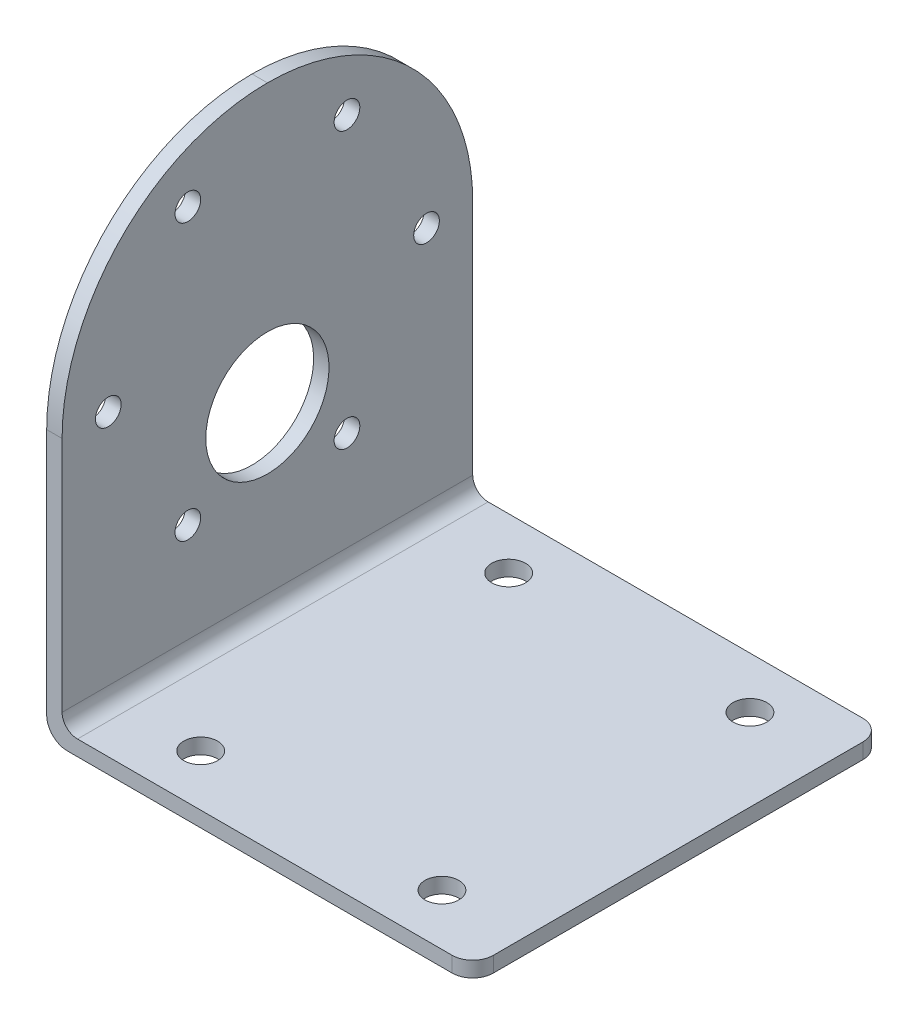
from build123d import *

# Parameters (mm, degrees)
SKETCH_1_W          = 41.5
SKETCH_1_H          = 40
EXTRUDE_1_DEPTH     = 1.5
SKETCH_2_W          = 1.5
SKETCH_2_H          = 40
EXTRUDE_2_DEPTH     = 44.6
FILLET_2_R          = 20
FILLET_3_R          = 20
SKETCH_3_R          = 1.25
SKETCH_3_R_2        = 6
CUT_EXTRUDE_1_DEPTH = 44.6
SKETCH_4_R          = 1.65
CUT_EXTRUDE_2_DEPTH = 44.6
FILLET_5_R          = 2
FILLET_6_R          = 2
FILLET_7_R          = 1.5


with BuildPart() as part:
    # Эскиз1 → Бобышка-Вытянуть1 (new body)
    with BuildSketch(Plane(origin=(0, 0, 0), x_dir=(1, 0, 0), z_dir=(0, 1, 0))):
        Rectangle(SKETCH_1_W, SKETCH_1_H)
    extrude(amount=EXTRUDE_1_DEPTH)

    # Эскиз2 → Бобышка-Вытянуть2 (add)
    with BuildSketch(Plane(origin=(0, 1.5, 0), x_dir=(1, 0, 0), z_dir=(0, 1, 0))):
        with Locations((-20, 0)):
            Rectangle(SKETCH_2_W, SKETCH_2_H)
    extrude(amount=EXTRUDE_2_DEPTH)

    # Скругление2
    fillet_2_edges = [part.edges().sort_by_distance(p)[0] for p in [
        (-20, 46.1, 20),
    ]]
    fillet(fillet_2_edges, radius=FILLET_2_R)

    # Скругление3
    fillet_3_edges = [part.edges().sort_by_distance(p)[0] for p in [
        (-20, 46.1, -20),
    ]]
    fillet(fillet_3_edges, radius=FILLET_3_R - 0.0001)  # a hair under: the kernel refuses the full size

    # Эскиз3 → Вырез-Вытянуть1 (cut)
    with BuildSketch(Plane.ZY.offset(20.75)):
        with Locations((-15.5, 26.1)):
            Circle(SKETCH_3_R)
        with Locations((-7.75, 39.523393759)):
            Circle(SKETCH_3_R)
        with Locations((7.75, 39.523393759)):
            Circle(SKETCH_3_R)
        with Locations((15.5, 26.1)):
            Circle(SKETCH_3_R)
        with Locations((7.75, 12.676606241)):
            Circle(SKETCH_3_R)
        with Locations((-7.75, 12.676606241)):
            Circle(SKETCH_3_R)
        with Locations((0, 19.1)):
            Circle(SKETCH_3_R_2)
    extrude(amount=-CUT_EXTRUDE_1_DEPTH, mode=Mode.SUBTRACT)

    # Эскиз4 → Вырез-Вытянуть2 (cut)
    with BuildSketch(Plane.XZ):
        with Locations(Location((12.75, 15, 0), (0, 0, 270))):
            Circle(SKETCH_4_R)
        with Locations(Location((-10.75, 15, 0), (0, 0, 270))):
            Circle(SKETCH_4_R)
        with Locations(Location((-10.75, -15, 0), (0, 0, 270))):
            Circle(SKETCH_4_R)
        with Locations(Location((12.75, -15, 0), (0, 0, 270))):
            Circle(SKETCH_4_R)
    extrude(amount=-CUT_EXTRUDE_2_DEPTH, mode=Mode.SUBTRACT)

    # Скругление5
    fillet_5_edges = [part.edges().sort_by_distance(p)[0] for p in [
        (20.75, 0.75, -20),
        (20.75, 0.75, 20),
    ]]
    fillet(fillet_5_edges, radius=FILLET_5_R)

    # Скругление6
    fillet_6_edges = [part.edges().sort_by_distance(p)[0] for p in [
        (-20.75, 0, 0),
    ]]
    fillet(fillet_6_edges, radius=FILLET_6_R)

    # Скругление7
    fillet_7_edges = [part.edges().sort_by_distance(p)[0] for p in [
        (-19.25, 1.5, 0),
    ]]
    fillet(fillet_7_edges, radius=FILLET_7_R)


solid = part.part
